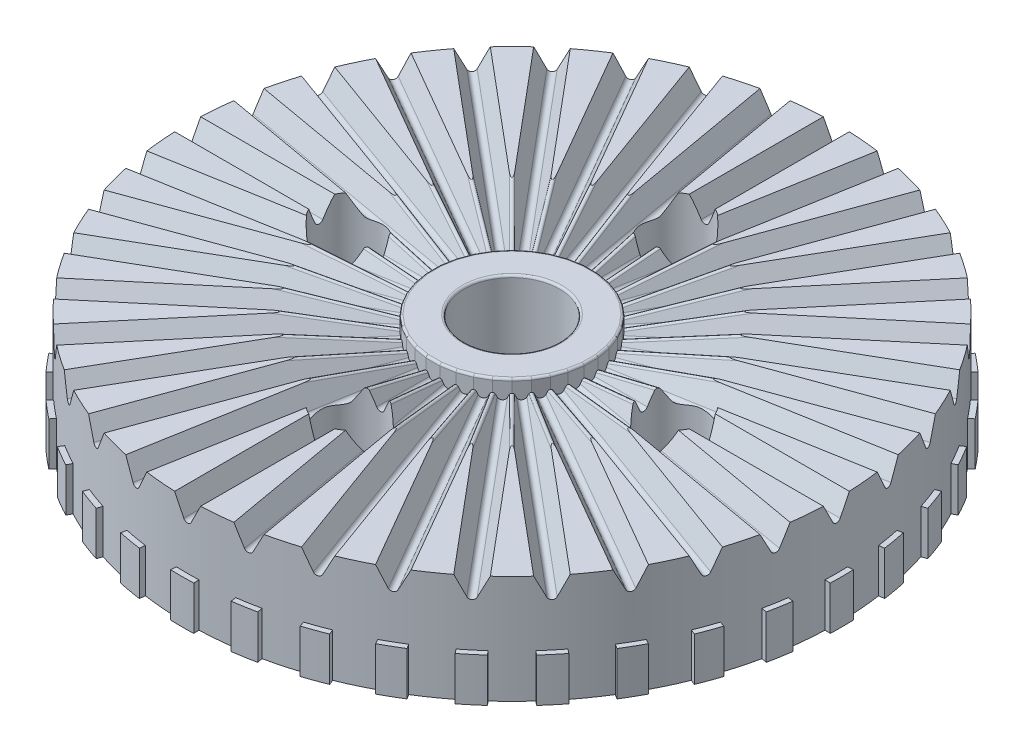
from build123d import *

# Parameters (mm, degrees)
SKETCH1_R               = 30
BOSS_EXTRUDE1_DEPTH     = 10
CUT_EXTRUDE4_DEPTH      = 23.7
CIRPATTERN3_COUNT       = 36
CUT_EXTRUDE1_REACH      = 45.589
SKETCH12_R              = 4.4
REVOLVE1_DEPTH          = 4.034852916
CIRPATTERN2_COUNT       = 36
CUT_EXTRUDE2_REACH      = 46.278
SKETCH14_R              = 1.6
CUT_EXTRUDE3_DEPTH      = 2
CUT_EXTRUDE3_DEPTH_BACK = 6
SKETCH15_R              = 2.85
FILLET1_R               = 0.2
SKETCH17_R              = 7.4
CUT_EXTRUDE5_DEPTH      = 0.2
FILLET2_R               = 0.2


# Read off the part's stored shape, not the designer's step: Revolve1
with BuildPart() as part:
    # Sketch1 → Boss-Extrude1 (new body)
    with BuildSketch(Plane(origin=(0, 0, 0), x_dir=(1, 0, 0), z_dir=(0, 1, 0))):
        with Locations(Location((0, 0, 0), (0, 0, 270))):
            Circle(SKETCH1_R)
    extrude(amount=BOSS_EXTRUDE1_DEPTH)

    # Sketch3 → Cut-Extrude4 (cut)
    with BuildSketch(Plane.XY.offset(31)):
        with BuildLine():
            Line((-1.2, 10), (1.2, 10))
            Line((1.2, 10), (0.339882333, 8.279764665))
            ThreePointArc((0.339882333, 8.279764665), (0, 8.069705831), (-0.339882333, 8.279764665))
            Line((-0.339882333, 8.279764665), (-1.2, 10))
        make_face()
    cut_extrude4 = extrude(amount=-CUT_EXTRUDE4_DEPTH, mode=Mode.SUBTRACT)

    # CirPattern3: Cut-Extrude4 ×36 about axis
    cirpattern3_axis = Axis((0, 0, 0), (0, 1, 0))
    for i in range(1, CIRPATTERN3_COUNT):
        add(cut_extrude4.rotate(cirpattern3_axis, i * 360 / CIRPATTERN3_COUNT), mode=Mode.SUBTRACT)

    # Sketch12 → Cut-Extrude1 (cut, up to next)
    with BuildSketch(Plane(origin=(0, 10, 0), x_dir=(1, 0, 0), z_dir=(0, 1, 0)), mode=Mode.PRIVATE) as cut_extrude1_sk1:
        with Locations(Location((0, 0, 0), (0, 0, 270))):
            Circle(SKETCH12_R)
    cut_extrude1_tool1 = extrude(cut_extrude1_sk1.sketch, amount=-CUT_EXTRUDE1_REACH, mode=Mode.PRIVATE) & part.part
    add(cut_extrude1_tool1.solids().sort_by_distance((0, 10, 0))[0], mode=Mode.SUBTRACT)

    # Revolve1 outline → Revolve1 (add)
    with BuildSketch(Plane(origin=(0, 0, 0), x_dir=(1, 0, 0), z_dir=(0, 1, 0))):
        with BuildLine():
            ThreePointArc((-30.481420224, 1.064434649), (-30.5, 0), (-30.481420224, -1.064434649))
            Line((-30.481420224, -1.064434649), (-29.981724811, -1.046984901))
            ThreePointArc((-29.981724811, -1.046984901), (-30, 0), (-29.981724811, 1.046984901))
            Line((-29.981724811, 1.046984901), (-30.481420224, 1.064434649))
        make_face()
    revolve1 = extrude(amount=REVOLVE1_DEPTH)

    # CirPattern2: Revolve1 ×36 about axis
    cirpattern2_axis = Axis((0, 0, 0), (0, 1, 0))
    for i in range(1, CIRPATTERN2_COUNT):
        add(revolve1.rotate(cirpattern2_axis, i * 360 / CIRPATTERN2_COUNT))

    # Sketch14 → Cut-Extrude2 (cut, up to next)
    with BuildSketch(Plane(origin=(0, 0, 0), x_dir=(1, 0, 0), z_dir=(0, 1, 0)), mode=Mode.PRIVATE) as cut_extrude2_sk1:
        with Locations(Location((-15, 0, 0), (0, 0, 108.603747321))):
            Circle(SKETCH14_R)
    cut_extrude2_tool1 = extrude(cut_extrude2_sk1.sketch, amount=CUT_EXTRUDE2_REACH, mode=Mode.PRIVATE) & part.part
    # Sketch14 → Cut-Extrude2 (cut, up to next)
    with BuildSketch(Plane(origin=(0, 0, 0), x_dir=(1, 0, 0), z_dir=(0, 1, 0)), mode=Mode.PRIVATE) as cut_extrude2_sk2:
        with Locations(Location((15, 0, 0), (0, 0, 90))):
            Circle(SKETCH14_R)
    cut_extrude2_tool2 = extrude(cut_extrude2_sk2.sketch, amount=CUT_EXTRUDE2_REACH, mode=Mode.PRIVATE) & part.part
    # Sketch14 → Cut-Extrude2 (cut, up to next)
    with BuildSketch(Plane(origin=(0, 0, 0), x_dir=(1, 0, 0), z_dir=(0, 1, 0)), mode=Mode.PRIVATE) as cut_extrude2_sk3:
        with Locations(Location((0, 15, 0), (0, 0, 77.735413108))):
            Circle(SKETCH14_R)
    cut_extrude2_tool3 = extrude(cut_extrude2_sk3.sketch, amount=CUT_EXTRUDE2_REACH, mode=Mode.PRIVATE) & part.part
    # Sketch14 → Cut-Extrude2 (cut, up to next)
    with BuildSketch(Plane(origin=(0, 0, 0), x_dir=(1, 0, 0), z_dir=(0, 1, 0)), mode=Mode.PRIVATE) as cut_extrude2_sk4:
        with Locations(Location((0, -15, 0), (0, 0, 90))):
            Circle(SKETCH14_R)
    cut_extrude2_tool4 = extrude(cut_extrude2_sk4.sketch, amount=CUT_EXTRUDE2_REACH, mode=Mode.PRIVATE) & part.part
    add(cut_extrude2_tool1.solids().sort_by_distance((-15, 0, 0))[0], mode=Mode.SUBTRACT)
    add(cut_extrude2_tool2.solids().sort_by_distance((15, 0, 0))[0], mode=Mode.SUBTRACT)
    add(cut_extrude2_tool3.solids().sort_by_distance((0, 0, -15))[0], mode=Mode.SUBTRACT)
    add(cut_extrude2_tool4.solids().sort_by_distance((0, 0, 15))[0], mode=Mode.SUBTRACT)

    # Sketch15 → Cut-Extrude3 (cut, two sides: drawn at the far end of the back side and taken through both)
    with BuildSketch(Plane(origin=(0, 10, 0), x_dir=(1, 0, 0), z_dir=(0, 1, 0)).offset(-CUT_EXTRUDE3_DEPTH_BACK)):
        with Locations(Location((-15, 0, 0), (0, 0, 117.37488147))):
            Circle(SKETCH15_R)
        with Locations(Location((15, 0, 0), (0, 0, 90))):
            Circle(SKETCH15_R)
        with Locations(Location((0, 15, 0), (0, 0, 83.150791758))):
            Circle(SKETCH15_R)
        with Locations(Location((0, -15, 0), (0, 0, 90))):
            Circle(SKETCH15_R)
    extrude(amount=CUT_EXTRUDE3_DEPTH + CUT_EXTRUDE3_DEPTH_BACK, mode=Mode.SUBTRACT)

    # Fillet1
    fillet1_edges = [part.edges().sort_by_distance(p)[0] for p in [
        (-2.730067379, 9.438667244, -10.188750165),
        (-4.45784942, 9.438667244, -9.559888931),
        (-6.050181962, 9.438667244, -8.640555309),
        (-7.458682787, 9.438667244, -7.458682787),
        (-8.640555309, 9.438667244, -6.050181962),
        (-9.559888931, 9.438667244, -4.45784942),
        (-10.188750165, 9.438667244, -2.730067379),
        (-9.831615636, 9.320309825, -0.860154912),
        (-9.831615636, 9.320309825, 0.860154912),
        (-10.188750165, 9.438667244, 2.730067379),
        (-9.559888931, 9.438667244, 4.45784942),
        (-8.640555309, 9.438667244, 6.050181962),
        (-7.458682787, 9.438667244, 7.458682787),
        (-6.050181962, 9.438667244, 8.640555309),
        (-4.45784942, 9.438667244, 9.559888931),
        (-2.730067379, 9.438667244, 10.188750165),
        (-0.860154912, 9.320309825, 9.831615636),
        (0.860154912, 9.320309825, 9.831615636),
        (2.730067379, 9.438667244, 10.188750165),
        (4.45784942, 9.438667244, 9.559888931),
        (6.050181962, 9.438667244, 8.640555309),
        (7.458682787, 9.438667244, 7.458682787),
        (8.640555309, 9.438667244, 6.050181962),
        (9.559888931, 9.438667244, 4.45784942),
        (10.188750165, 9.438667244, 2.730067379),
        (9.831615636, 9.320309825, 0.860154912),
        (9.831615636, 9.320309825, -0.860154912),
        (10.188750165, 9.438667244, -2.730067379),
        (9.559888931, 9.438667244, -4.45784942),
        (8.640555309, 9.438667244, -6.050181962),
        (7.458682787, 9.438667244, -7.458682787),
        (6.050181962, 9.438667244, -8.640555309),
        (4.45784942, 9.438667244, -9.559888931),
        (2.730067379, 9.438667244, -10.188750165),
        (0.860154912, 9.320309825, -9.831615636),
        (-0.860154912, 9.320309825, -9.831615636),
    ]]
    fillet(fillet1_edges, radius=FILLET1_R)

    # Sketch17 → Cut-Extrude5 (cut)
    with BuildSketch(Plane(origin=(0, 10, 0), x_dir=(1, 0, 0), z_dir=(0, 1, 0))):
        Circle(SKETCH17_R)
    extrude(amount=-CUT_EXTRUDE5_DEPTH, mode=Mode.SUBTRACT)

    # Fillet2
    fillet2_edges = [part.edges().sort_by_distance(p)[0] for p in [
        (-1.267631697, 9.8, 7.189096597),
        (0, 9.8, 7.3),
        (1.267631697, 9.8, 7.189096597),
        (2.496747046, 9.8, 6.859756132),
        (3.65, 9.8, 6.321985448),
        (4.692349551, 9.8, 5.592124435),
        (5.592124435, 9.8, 4.692349551),
        (6.321985448, 9.8, 3.65),
        (6.859756132, 9.8, 2.496747046),
        (7.189096597, 9.8, 1.267631697),
        (7.3, 9.8, 0),
        (7.189096597, 9.8, -1.267631697),
        (6.859756132, 9.8, -2.496747046),
        (6.321985448, 9.8, -3.65),
        (5.592124435, 9.8, -4.692349551),
        (4.692349551, 9.8, -5.592124435),
        (3.65, 9.8, -6.321985448),
        (2.496747046, 9.8, -6.859756132),
        (1.267631697, 9.8, -7.189096597),
        (0, 9.8, -7.3),
        (-1.267631697, 9.8, -7.189096597),
        (-2.496747046, 9.8, -6.859756132),
        (-3.65, 9.8, -6.321985448),
        (-4.692349551, 9.8, -5.592124435),
        (-5.592124435, 9.8, -4.692349551),
        (-6.321985448, 9.8, -3.65),
        (-6.859756132, 9.8, -2.496747046),
        (-7.189096597, 9.8, -1.267631697),
        (-7.3, 9.8, 0),
        (-7.189096597, 9.8, 1.267631697),
        (-6.859756132, 9.8, 2.496747046),
        (-6.321985448, 9.8, 3.65),
        (-5.592124435, 9.8, 4.692349551),
        (-4.692349551, 9.8, 5.592124435),
        (-3.65, 9.8, 6.321985448),
        (-2.496747046, 9.8, 6.859756132),
        (0, 9.8, -4.4),
    ]]
    fillet(fillet2_edges, radius=FILLET2_R)


solid = part.part
